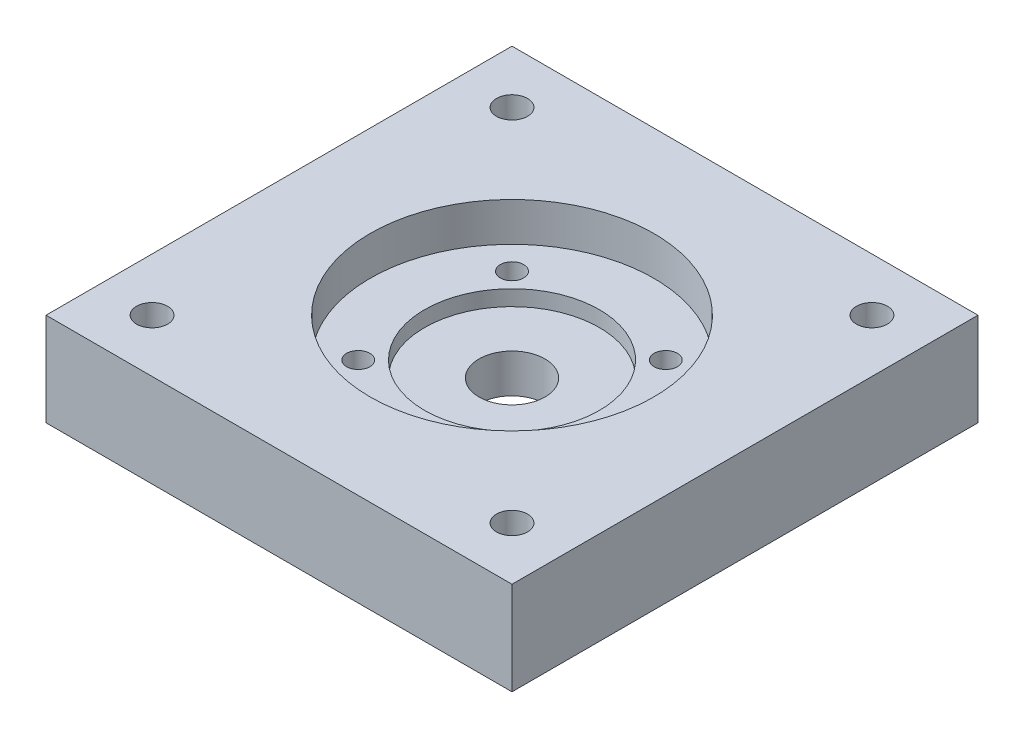
from build123d import *

# Parameters (mm, degrees)
SKETCH_1_W      = 60
SKETCH_1_H      = 60
SKETCH_1_R      = 2
SKETCH_1_R_2    = 1.5
SKETCH_1_R_3    = 4.25
EXTRUDE_1_DEPTH = 5
SKETCH_2_W      = 60
SKETCH_2_H      = 60
SKETCH_2_R      = 1.5
SKETCH_2_R_2    = 2
SKETCH_2_R_3    = 11.25
EXTRUDE_2_DEPTH = 2
SKETCH_3_W      = 60
SKETCH_3_H      = 60
SKETCH_3_R      = 18.25
SKETCH_3_R_2    = 2
EXTRUDE_3_DEPTH = 5


with BuildPart() as part:
    # 草图1 → 凸台-拉伸1 (new body)
    with BuildSketch(Plane(origin=(0, 0, 0), x_dir=(1, 0, 0), z_dir=(0, 1, 0))):
        Rectangle(SKETCH_1_W, SKETCH_1_H)
        with Locations((23.171320344, 23.171320344)):
            Circle(SKETCH_1_R, mode=Mode.SUBTRACT)
        with Locations((-23.171320344, -23.171320344)):
            Circle(SKETCH_1_R, mode=Mode.SUBTRACT)
        with Locations((23.171320344, -23.171320344)):
            Circle(SKETCH_1_R, mode=Mode.SUBTRACT)
        with Locations((-23.171320344, 23.171320344)):
            Circle(SKETCH_1_R, mode=Mode.SUBTRACT)
        with Locations((9.899494937, 9.899494937)):
            Circle(SKETCH_1_R_2, mode=Mode.SUBTRACT)
        with Locations((-9.899494937, 9.899494937)):
            Circle(SKETCH_1_R_2, mode=Mode.SUBTRACT)
        with Locations((-9.899494937, -9.899494937)):
            Circle(SKETCH_1_R_2, mode=Mode.SUBTRACT)
        with Locations((9.899494937, -9.899494937)):
            Circle(SKETCH_1_R_2, mode=Mode.SUBTRACT)
        Circle(SKETCH_1_R_3, mode=Mode.SUBTRACT)
    extrude(amount=EXTRUDE_1_DEPTH)

    # 草图2 → 凸台-拉伸2 (add)
    with BuildSketch(Plane(origin=(0, 5, 0), x_dir=(1, 0, 0), z_dir=(0, 1, 0))):
        Rectangle(SKETCH_2_W, SKETCH_2_H)
        with Locations((-9.899494937, -9.899494937)):
            Circle(SKETCH_2_R, mode=Mode.SUBTRACT)
        with Locations((9.899494937, -9.899494937)):
            Circle(SKETCH_2_R, mode=Mode.SUBTRACT)
        with Locations((9.899494937, 9.899494937)):
            Circle(SKETCH_2_R, mode=Mode.SUBTRACT)
        with Locations((-9.899494937, 9.899494937)):
            Circle(SKETCH_2_R, mode=Mode.SUBTRACT)
        with Locations((-23.171320344, -23.171320344)):
            Circle(SKETCH_2_R_2, mode=Mode.SUBTRACT)
        with Locations((23.171320344, 23.171320344)):
            Circle(SKETCH_2_R_2, mode=Mode.SUBTRACT)
        with Locations((23.171320344, -23.171320344)):
            Circle(SKETCH_2_R_2, mode=Mode.SUBTRACT)
        with Locations((-23.171320344, 23.171320344)):
            Circle(SKETCH_2_R_2, mode=Mode.SUBTRACT)
        Circle(SKETCH_2_R_3, mode=Mode.SUBTRACT)
    extrude(amount=EXTRUDE_2_DEPTH)

    # 草图3 → 凸台-拉伸3 (add)
    with BuildSketch(Plane(origin=(0, 7, 0), x_dir=(1, 0, 0), z_dir=(0, 1, 0))):
        Rectangle(SKETCH_3_W, SKETCH_3_H)
        Circle(SKETCH_3_R, mode=Mode.SUBTRACT)
        with Locations((-23.171320344, -23.171320344)):
            Circle(SKETCH_3_R_2, mode=Mode.SUBTRACT)
        with Locations((23.171320344, 23.171320344)):
            Circle(SKETCH_3_R_2, mode=Mode.SUBTRACT)
        with Locations((23.171320344, -23.171320344)):
            Circle(SKETCH_3_R_2, mode=Mode.SUBTRACT)
        with Locations((-23.171320344, 23.171320344)):
            Circle(SKETCH_3_R_2, mode=Mode.SUBTRACT)
    extrude(amount=EXTRUDE_3_DEPTH)


solid = part.part
